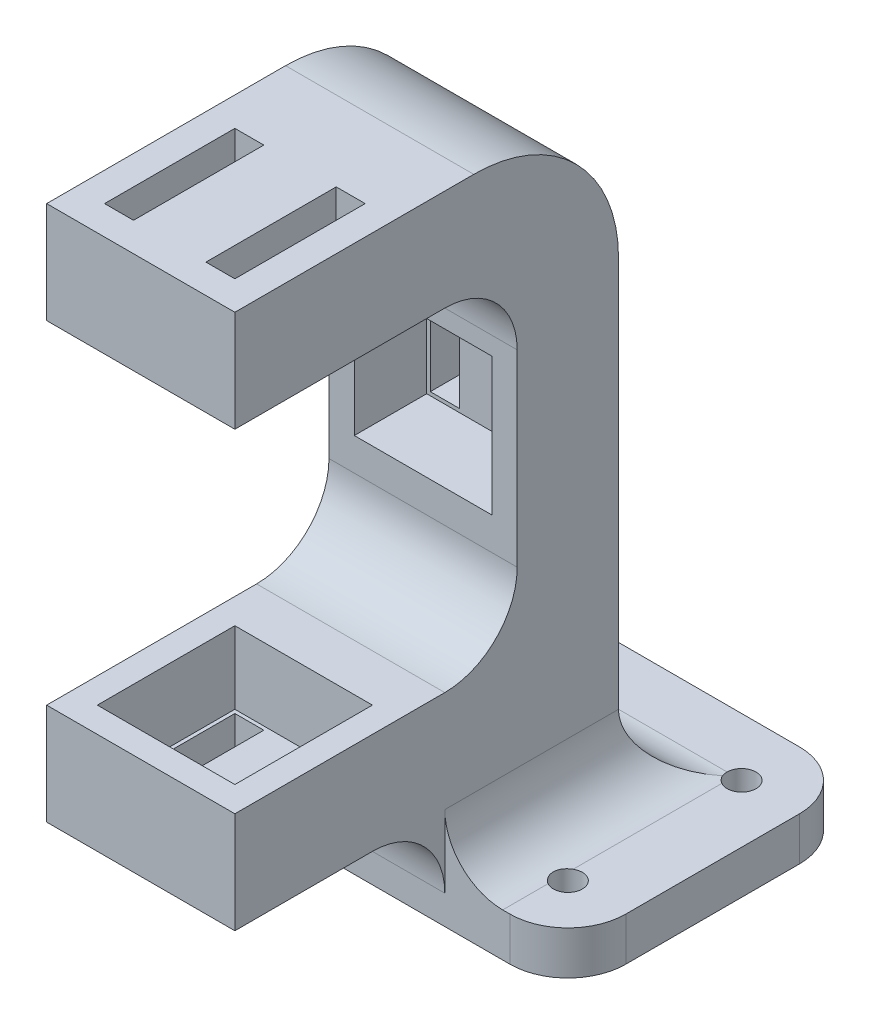
from build123d import *

# Parameters (mm, degrees)
SKETCH1_W            = 13
SKETCH1_H            = 13
SKETCH1_W_2          = 5
SKETCH1_H_2          = 9
BOSS_EXTRUDE1_DEPTH  = 2
SKETCH2_W            = 13
SKETCH2_H            = 13
SKETCH2_W_2          = 9.5
SKETCH2_H_2          = 9.5
BOSS_EXTRUDE2_DEPTH  = 5
SKETCH3_W            = 13
SKETCH3_H            = 13
SKETCH3_W_2          = 5
SKETCH3_H_2          = 9
BOSS_EXTRUDE3_DEPTH  = 2
SKETCH4_W            = 13
SKETCH4_H            = 13
SKETCH4_W_2          = 9.5
SKETCH4_H_2          = 9.5
BOSS_EXTRUDE4_DEPTH  = 5
SKETCH5_W            = 13
SKETCH5_H            = 13
SKETCH5_W_2          = 5
SKETCH5_H_2          = 9
BOSS_EXTRUDE5_DEPTH  = 2
SKETCH6_W            = 13
SKETCH6_H            = 13
SKETCH6_W_2          = 9.5
SKETCH6_H_2          = 9.5
BOSS_EXTRUDE6_DEPTH  = 5
SKETCH7_W            = 13
SKETCH7_H            = 7
BOSS_EXTRUDE7_DEPTH  = 12.5
SKETCH8_W            = 13
SKETCH8_H            = 7
BOSS_EXTRUDE8_DEPTH  = 11.5
BOSS_EXTRUDE9_REACH  = 27.797
SKETCH9_W            = 13
SKETCH9_H            = 7
SKETCH10_W           = 13
SKETCH10_H           = 12
BOSS_EXTRUDE10_DEPTH = 7
SKETCH11_W           = 30
SKETCH11_H           = 20
BOSS_EXTRUDE11_DEPTH = 3
FILLET1_R            = 4
CUT_EXTRUDE1_REACH   = 62.042
SKETCH12_R           = 1
FILLET2_R            = 10
FILLET3_R            = 5


with BuildPart() as part:
    # Sketch1 → Boss-Extrude1 (new body)
    # profile 1 of 2: a face of its own
    with BuildSketch(Plane.XZ.offset(14)):
        with Locations((0, -10)):
            Rectangle(SKETCH1_W, SKETCH1_H)
        Polygon((-4.5, -14.5), (-2.5, -14.5), (2.5, -14.5), (4.5, -14.5), (4.5, -5.5), (2.5, -5.5), (-2.5, -5.5), (-4.5, -5.5), align=None, mode=Mode.SUBTRACT)
    # profile 2 of 2: a face of its own
    with BuildSketch(Plane.XZ.offset(14)):
        with Locations((0, -10)):
            Rectangle(SKETCH1_W_2, SKETCH1_H_2)
    extrude(amount=BOSS_EXTRUDE1_DEPTH)

    # Sketch2 → Boss-Extrude2 (add)
    with BuildSketch(Plane(origin=(0, -14, 0), x_dir=(1, 0, 0), z_dir=(0, 1, 0))):
        with Locations((0, 10)):
            Rectangle(SKETCH2_W, SKETCH2_H)
        with Locations((0, 10)):
            Rectangle(SKETCH2_W_2, SKETCH2_H_2, mode=Mode.SUBTRACT)
    extrude(amount=BOSS_EXTRUDE2_DEPTH)


with BuildPart() as body_2:
    # Sketch3 → Boss-Extrude3 (new body)
    # profile 1 of 2: a face of its own
    with BuildSketch(Plane(origin=(0, 0, -28), x_dir=(-1, 0, 0), z_dir=(0, 0, -1))):
        with Locations((0, 3)):
            Rectangle(SKETCH3_W, SKETCH3_H)
        Polygon((4.5, -1.5), (2.5, -1.5), (-2.5, -1.5), (-4.5, -1.5), (-4.5, 7.5), (-2.5, 7.5), (2.5, 7.5), (4.5, 7.5), align=None, mode=Mode.SUBTRACT)
    # profile 2 of 2: a face of its own
    with BuildSketch(Plane(origin=(0, 0, -28), x_dir=(-1, 0, 0), z_dir=(0, 0, -1))):
        with Locations((0, 3)):
            Rectangle(SKETCH3_W_2, SKETCH3_H_2)
    extrude(amount=BOSS_EXTRUDE3_DEPTH)

    # Sketch4 → Boss-Extrude4 (add)
    with BuildSketch(Plane.XY.offset(-28)):
        with Locations((0, 3)):
            Rectangle(SKETCH4_W, SKETCH4_H)
        with Locations((0, 3)):
            Rectangle(SKETCH4_W_2, SKETCH4_H_2, mode=Mode.SUBTRACT)
    extrude(amount=BOSS_EXTRUDE4_DEPTH)

    # Sketch7 → Boss-Extrude7 (add)
    with BuildSketch(Plane.XZ.offset(3.5)):
        with Locations((0, -26.5)):
            Rectangle(SKETCH7_W, SKETCH7_H)
    extrude(amount=BOSS_EXTRUDE7_DEPTH)

    # Sketch8 → Boss-Extrude8 (add)
    with BuildSketch(Plane(origin=(0, 9.5, 0), x_dir=(1, 0, 0), z_dir=(0, 1, 0))):
        with Locations((0, 26.5)):
            Rectangle(SKETCH8_W, SKETCH8_H)
    extrude(amount=BOSS_EXTRUDE8_DEPTH)

    # Sketch9 → Boss-Extrude9 (add, up to next)
    with BuildSketch(Plane(origin=(0, 0, -16.5), x_dir=(-1, 0, 0), z_dir=(0, 0, -1)), mode=Mode.PRIVATE) as boss_extrude9_sk1:
        with Locations((0, -12.5)):
            Rectangle(SKETCH9_W, SKETCH9_H)
    boss_extrude9_tool1 = extrude(boss_extrude9_sk1.sketch, amount=BOSS_EXTRUDE9_REACH, mode=Mode.PRIVATE) - body_2.part
    # Sketch9 → Boss-Extrude9 (add, up to next)
    with BuildSketch(Plane(origin=(0, 0, -16.5), x_dir=(-1, 0, 0), z_dir=(0, 0, -1)), mode=Mode.PRIVATE) as boss_extrude9_sk2:
        with Locations((0, 17.5)):
            Rectangle(SKETCH9_W, SKETCH9_H)
    boss_extrude9_tool2 = extrude(boss_extrude9_sk2.sketch, amount=BOSS_EXTRUDE9_REACH, mode=Mode.PRIVATE) - body_2.part

    add(part.part)  # Boss-Extrude9 merges part


with BuildPart() as body_3:
    # Sketch5 → Boss-Extrude5 (new body)
    # profile 1 of 2: a face of its own
    with BuildSketch(Plane(origin=(0, 19, 0), x_dir=(1, 0, 0), z_dir=(0, 1, 0))):
        with Locations((0, 10)):
            Rectangle(SKETCH5_W, SKETCH5_H)
        Polygon((-4.5, 14.5), (-2.5, 14.5), (2.5, 14.5), (4.5, 14.5), (4.5, 5.5), (2.5, 5.5), (-2.5, 5.5), (-4.5, 5.5), align=None, mode=Mode.SUBTRACT)
    # profile 2 of 2: a face of its own
    with BuildSketch(Plane(origin=(0, 19, 0), x_dir=(1, 0, 0), z_dir=(0, 1, 0))):
        with Locations((0, 10)):
            Rectangle(SKETCH5_W_2, SKETCH5_H_2)
    extrude(amount=BOSS_EXTRUDE5_DEPTH)

    # Sketch6 → Boss-Extrude6 (add)
    with BuildSketch(Plane.XZ.offset(-19)):
        with Locations((0, -10)):
            Rectangle(SKETCH6_W, SKETCH6_H)
        with Locations((0, -10)):
            Rectangle(SKETCH6_W_2, SKETCH6_H_2, mode=Mode.SUBTRACT)
    extrude(amount=BOSS_EXTRUDE6_DEPTH)


with BuildPart() as body_2_1:
    add(body_2.part)

    add(body_3.part)  # Boss-Extrude9 merges body 3
    add(boss_extrude9_tool1.solids().sort_by_distance((0, -12.5, -16.5))[0])
    add(boss_extrude9_tool2.solids().sort_by_distance((0, 17.5, -16.5))[0])

    # Sketch10 → Boss-Extrude10 (add)
    with BuildSketch(Plane.XZ.offset(16)):
        with Locations((0, -24)):
            Rectangle(SKETCH10_W, SKETCH10_H)
    extrude(amount=BOSS_EXTRUDE10_DEPTH)

    # Sketch11 → Boss-Extrude11 (add)
    with BuildSketch(Plane.XZ.offset(23)):
        with Locations((0, -28)):
            Rectangle(SKETCH11_W, SKETCH11_H)
    extrude(amount=-BOSS_EXTRUDE11_DEPTH)

    # Fillet1
    fillet1_edges = [body_2_1.edges().sort_by_distance(p)[0] for p in [
        (6.5, -20, -24),
        (-6.5, -20, -24),
        (0, -20, -30),
        (-15, -21.5, -18),
        (-15, -21.5, -38),
        (15, -21.5, -18),
        (15, -21.5, -38),
    ]]
    fillet(fillet1_edges, radius=FILLET1_R)

    # Sketch12 → Cut-Extrude1 (cut, up to next)
    with BuildSketch(Plane.XZ.offset(23), mode=Mode.PRIVATE) as cut_extrude1_sk1:
        with Locations(Location((-11, -22, 0), (0, 0, 270))):
            Circle(SKETCH12_R)
    cut_extrude1_tool1 = extrude(cut_extrude1_sk1.sketch, amount=-CUT_EXTRUDE1_REACH, mode=Mode.PRIVATE) & body_2_1.part
    # Sketch12 → Cut-Extrude1 (cut, up to next)
    with BuildSketch(Plane.XZ.offset(23), mode=Mode.PRIVATE) as cut_extrude1_sk2:
        with Locations(Location((11, -22, 0), (0, 0, 270))):
            Circle(SKETCH12_R)
    cut_extrude1_tool2 = extrude(cut_extrude1_sk2.sketch, amount=-CUT_EXTRUDE1_REACH, mode=Mode.PRIVATE) & body_2_1.part
    # Sketch12 → Cut-Extrude1 (cut, up to next)
    with BuildSketch(Plane.XZ.offset(23), mode=Mode.PRIVATE) as cut_extrude1_sk3:
        with Locations(Location((11, -34, 0), (0, 0, 270))):
            Circle(SKETCH12_R)
    cut_extrude1_tool3 = extrude(cut_extrude1_sk3.sketch, amount=-CUT_EXTRUDE1_REACH, mode=Mode.PRIVATE) & body_2_1.part
    # Sketch12 → Cut-Extrude1 (cut, up to next)
    with BuildSketch(Plane.XZ.offset(23), mode=Mode.PRIVATE) as cut_extrude1_sk4:
        with Locations(Location((-11, -34, 0), (0, 0, 270))):
            Circle(SKETCH12_R)
    cut_extrude1_tool4 = extrude(cut_extrude1_sk4.sketch, amount=-CUT_EXTRUDE1_REACH, mode=Mode.PRIVATE) & body_2_1.part
    add(cut_extrude1_tool1.solids().sort_by_distance((-11, -23, -22))[0], mode=Mode.SUBTRACT)
    add(cut_extrude1_tool2.solids().sort_by_distance((11, -23, -22))[0], mode=Mode.SUBTRACT)
    add(cut_extrude1_tool3.solids().sort_by_distance((11, -23, -34))[0], mode=Mode.SUBTRACT)
    add(cut_extrude1_tool4.solids().sort_by_distance((-11, -23, -34))[0], mode=Mode.SUBTRACT)

    # Fillet2
    fillet2_edges = [body_2_1.edges().sort_by_distance(p)[0] for p in [
        (0, 21, -30),
    ]]
    fillet(fillet2_edges, radius=FILLET2_R)

    # Fillet3
    # the kernel refuses this fillet: 5 mm, written as the material it adds along each edge
    with BuildSketch(Plane(origin=(-6.5, 14, -23), x_dir=(0, 0, 1), z_dir=(1, 0, 0)), Plane(origin=(6.5, -9, -23), x_dir=(0, 0, 1), z_dir=(-1, 0, 0))) as fillet3_piece_1:
        with BuildLine():
            CenterArc((FILLET3_R, FILLET3_R), FILLET3_R, 180, 90)
            Line((0, FILLET3_R), (0, 0))
            Line((0, 0), (FILLET3_R, 0))
        make_face()
    extrude(amount=13)
    with BuildSketch(Plane(origin=(-6.5, -16, -18), x_dir=(0, 0, 1), z_dir=(1, 0, 0))) as fillet3_piece_2_section:
        with BuildLine():
            CenterArc((FILLET3_R, FILLET3_R), FILLET3_R, 180, 90)
            Line((0, FILLET3_R), (0, 0))
            Line((0, 0), (FILLET3_R, 0))
        make_face()
    fillet3_piece_2 = extrude(amount=13, mode=Mode.PRIVATE)
    fillet3_piece_2 = split(fillet3_piece_2, bisect_by=Plane(origin=(-5.5, -20.249492121, -14.5), z_dir=(0, 0, -1)), keep=Keep.TOP, mode=Mode.PRIVATE)
    add(fillet3_piece_2)
    with BuildSketch(Plane(origin=(-6.5, -16, -18), x_dir=(0, 0, 1), z_dir=(1, 0, 0))) as fillet3_piece_3_section:
        with BuildLine():
            CenterArc((FILLET3_R, FILLET3_R), FILLET3_R, 180, 90)
            Line((0, FILLET3_R), (0, 0))
            Line((0, 0), (FILLET3_R, 0))
        make_face()
    fillet3_piece_3 = extrude(amount=25.5, mode=Mode.PRIVATE)
    fillet3_piece_3 = split(fillet3_piece_3, bisect_by=Plane(origin=(-4.5, -16.06880959, -14.126748988), z_dir=(-1, 0, 0)), keep=Keep.TOP, mode=Mode.PRIVATE)
    add(fillet3_piece_3)
    with BuildSketch(Plane(origin=(-19, -16, -18), x_dir=(0, 0, 1), z_dir=(1, 0, 0))) as fillet3_piece_4_section:
        with BuildLine():
            CenterArc((FILLET3_R, FILLET3_R), FILLET3_R, 180, 90)
            Line((0, FILLET3_R), (0, 0))
            Line((0, 0), (FILLET3_R, 0))
        make_face()
    fillet3_piece_4 = extrude(amount=38, mode=Mode.PRIVATE)
    fillet3_piece_4 = split(fillet3_piece_4, bisect_by=Plane(origin=(-2.5, -16.06880959, -14.126748988), z_dir=(1, 0, 0)), keep=Keep.TOP, mode=Mode.PRIVATE)
    fillet3_piece_4 = split(fillet3_piece_4, bisect_by=Plane(origin=(2.5, -16.06880959, -14.126748988), z_dir=(-1, 0, 0)), keep=Keep.TOP, mode=Mode.PRIVATE)
    add(fillet3_piece_4)
    with BuildSketch(Plane(origin=(-19, -16, -18), x_dir=(0, 0, 1), z_dir=(1, 0, 0))) as fillet3_piece_5_section:
        with BuildLine():
            CenterArc((FILLET3_R, FILLET3_R), FILLET3_R, 180, 90)
            Line((0, FILLET3_R), (0, 0))
            Line((0, 0), (FILLET3_R, 0))
        make_face()
    fillet3_piece_5 = extrude(amount=25.5, mode=Mode.PRIVATE)
    fillet3_piece_5 = split(fillet3_piece_5, bisect_by=Plane(origin=(4.5, -16.06880959, -14.12674899), z_dir=(1, 0, 0)), keep=Keep.TOP, mode=Mode.PRIVATE)
    add(fillet3_piece_5)


solid = body_2_1.part
